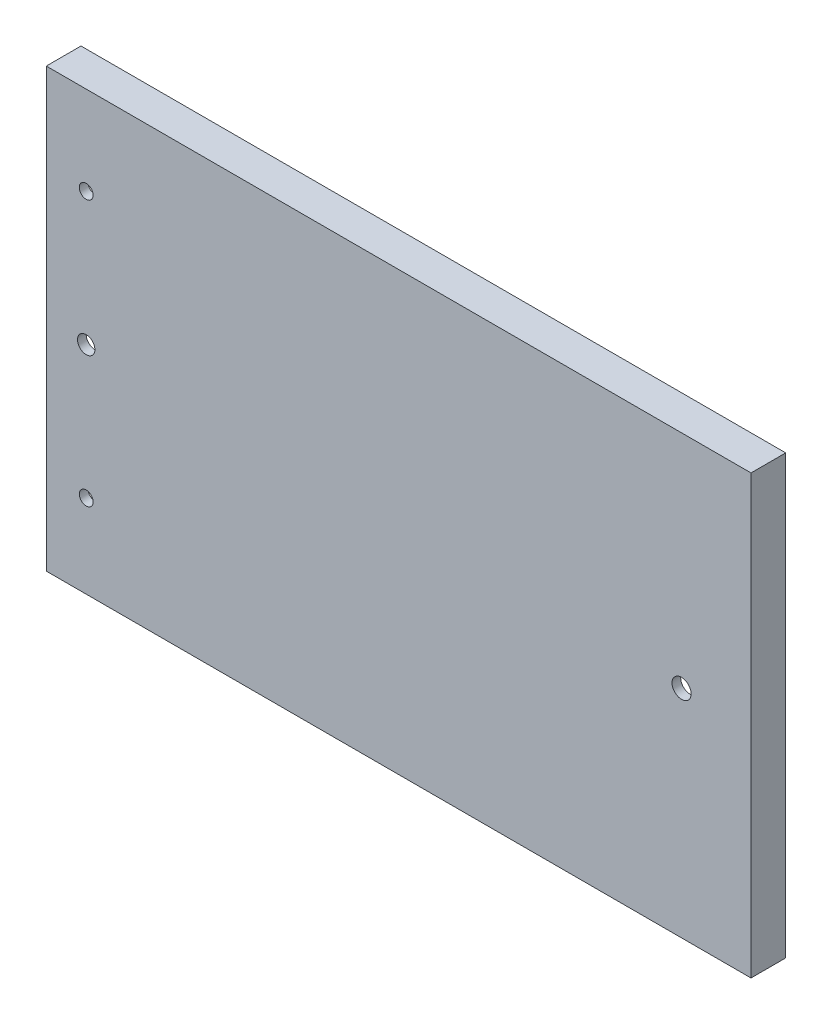
from build123d import *

# Parameters (mm, degrees)
SKETCH_1_W              = 406
SKETCH_1_H              = 252
EXTRUDE_1_DEPTH         = 20
SKETCH_2_W              = 385
SKETCH_2_H              = 236
CUT_EXTRUDE_1_DEPTH     = 15
HOLE_WIZARD_10_0_10_1_D = 10
HOLE_WIZARD_8_0_8_1_D   = 8
HOLE_WIZARD_11_0_11_1_D = 11


with BuildPart() as part:
    # Эскиз1 → Бобышка-Вытянуть1 (new body)
    with BuildSketch(Plane(origin=(0, 0, 0), x_dir=(-1, 0, 0), z_dir=(0, 0, -1))):
        with Locations((-203, 126)):
            Rectangle(SKETCH_1_W, SKETCH_1_H)
    extrude(amount=-EXTRUDE_1_DEPTH)

    # Эскиз2 → Вырез-Вытянуть1 (cut)
    with BuildSketch(Plane(origin=(0, 0, 0), x_dir=(-1, 0, 0), z_dir=(0, 0, -1))):
        with Locations((-195.5, 126)):
            Rectangle(SKETCH_2_W, SKETCH_2_H)
    extrude(amount=-CUT_EXTRUDE_1_DEPTH, mode=Mode.SUBTRACT)

    # Диаметр отверстия Ø10.0 (10)1 (through all)
    with Locations(Plane(origin=(0, 0, 15), x_dir=(-1, 0, 0), z_dir=(0, 0, -1))):
        with Locations((-23, 124.5)):
            Hole(HOLE_WIZARD_10_0_10_1_D / 2)

    # Диаметр отверстия Ø8.0 (8)1 (through all)
    with Locations(Plane(origin=(0, 0, 15), x_dir=(-1, 0, 0), z_dir=(0, 0, -1))):
        with Locations((-23, 201), (-23, 48)):
            Hole(HOLE_WIZARD_8_0_8_1_D / 2)

    # Диаметр отверстия Ø11.0 (11)1 (through all)
    with Locations(Plane(origin=(0, 0, 15), x_dir=(-1, 0, 0), z_dir=(0, 0, -1))):
        with Locations((-366, 124.5)):
            Hole(HOLE_WIZARD_11_0_11_1_D / 2)


solid = part.part
